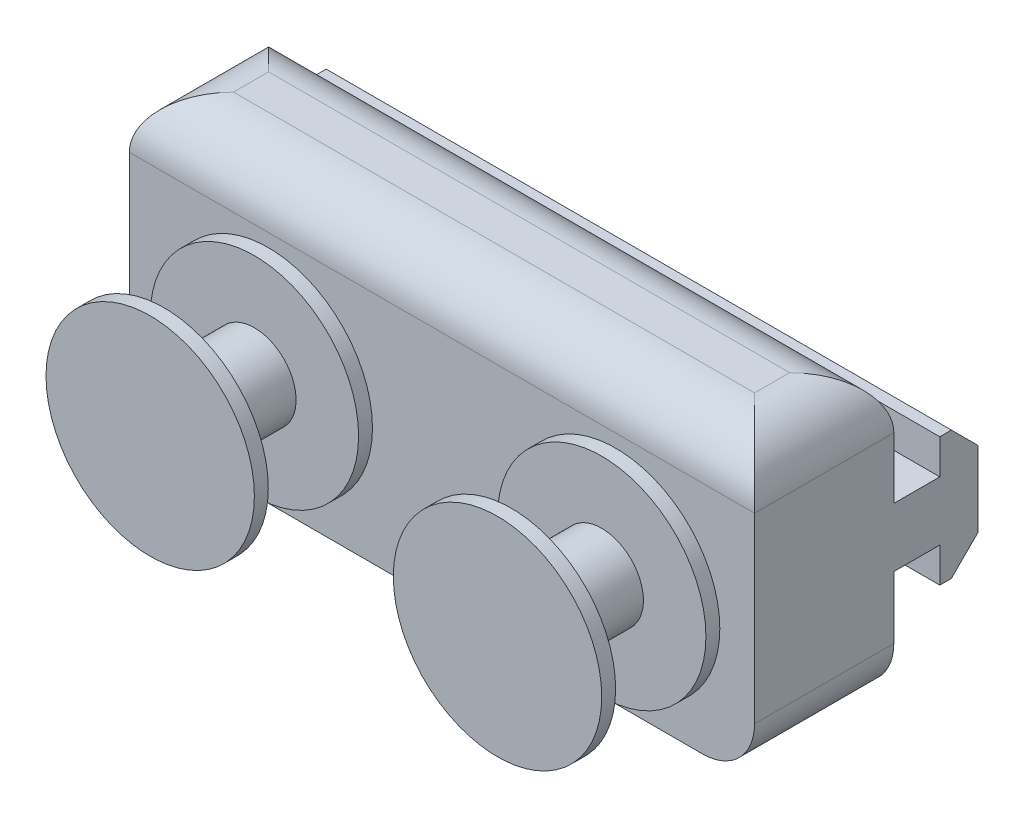
from build123d import *

# Parameters (mm, degrees)
BOSS_EXTRUDE2_DEPTH = 90
CUT_EXTRUDE1_DEPTH  = 30
FILLET1_R           = 7.5
SKETCH4_R           = 15
BOSS_EXTRUDE4_DEPTH = 2
SKETCH5_R           = 6
BOSS_EXTRUDE5_DEPTH = 13
SKETCH7_R           = 15
BOSS_EXTRUDE6_DEPTH = 2


with BuildPart() as part:
    # Sketch2 → Boss-Extrude2 (new body)
    with BuildSketch(Plane(origin=(0, 0, 0), x_dir=(0, 0, -1), z_dir=(1, 0, 0))):
        Polygon((-14.38168799, 3.616994595), (-21, 3.616994595), (-21, 19.916342715), (-41.04895965, 19.916342715), (-41.04895965, -21.33863134), (-21, -21.33863134), (-21, -4.883005405), (-14.38168799, -4.883005405), (-14.38168799, -9.883005405), (-12.710115115, -9.883005405), (-8.88168799, -6.05457828), (-8.88168799, 4.78856747), (-12.710115115, 8.616994595), (-14.38168799, 8.616994595), align=None)
    extrude(amount=BOSS_EXTRUDE2_DEPTH)

    # Sketch3 → Cut-Extrude1 (cut)
    with BuildSketch(Plane.XZ.offset(21.33863134)):
        with BuildLine():
            ThreePointArc((61.003137458, 39.024479825), (59.942477286, 38.585139997), (59.503137458, 37.524479825))
            Line((59.503137458, 37.524479825), (59.503137458, 33.024479825))
            ThreePointArc((59.503137458, 33.024479825), (59.737452033, 32.4587944), (60.303137458, 32.224479825))
            Line((60.303137458, 32.224479825), (61.603137458, 32.224479825))
            Line((61.603137458, 32.224479825), (61.603137458, 33.374479825))
            Line((61.603137458, 33.374479825), (63.496030677, 33.374479825))
            Line((63.496030677, 33.374479825), (64.203137458, 32.667373044))
            Line((64.203137458, 32.667373044), (64.203137458, 31.410120471))
            Line((64.203137458, 31.410120471), (64.425787189, 31.024479825))
            Line((64.425787189, 31.024479825), (64.203137458, 30.638839179))
            Line((64.203137458, 30.638839179), (64.203137458, 29.381586606))
            Line((64.203137458, 29.381586606), (63.496030677, 28.674479825))
            Line((63.496030677, 28.674479825), (61.603137458, 28.674479825))
            Line((61.603137458, 28.674479825), (61.603137458, 29.824479825))
            Line((61.603137458, 29.824479825), (60.303137458, 29.824479825))
            ThreePointArc((60.303137458, 29.824479825), (59.737452033, 29.59016525), (59.503137458, 29.024479825))
            Line((59.503137458, 29.024479825), (59.503137458, 24.524479825))
            ThreePointArc((59.503137458, 24.524479825), (59.942477286, 23.463819653), (61.003137458, 23.024479825))
            Line((61.003137458, 23.024479825), (65.503137458, 23.024479825))
            ThreePointArc((65.503137458, 23.024479825), (66.068822883, 23.2587944), (66.303137458, 23.824479825))
            Line((66.303137458, 23.824479825), (66.303137458, 25.124479825))
            Line((66.303137458, 25.124479825), (65.153137458, 25.124479825))
            Line((65.153137458, 25.124479825), (65.153137458, 27.017373044))
            Line((65.153137458, 27.017373044), (65.860244239, 27.724479825))
            Line((65.860244239, 27.724479825), (67.117496812, 27.724479825))
            Line((67.117496812, 27.724479825), (67.503137458, 27.947129556))
            Line((67.503137458, 27.947129556), (67.888778104, 27.724479825))
            Line((67.888778104, 27.724479825), (69.146030677, 27.724479825))
            Line((69.146030677, 27.724479825), (69.853137458, 27.017373044))
            Line((69.853137458, 27.017373044), (69.853137458, 25.124479825))
            Line((69.853137458, 25.124479825), (68.703137458, 25.124479825))
            Line((68.703137458, 25.124479825), (68.703137458, 23.824479825))
            ThreePointArc((68.703137458, 23.824479825), (68.937452033, 23.2587944), (69.503137458, 23.024479825))
            Line((69.503137458, 23.024479825), (74.003137458, 23.024479825))
            ThreePointArc((74.003137458, 23.024479825), (75.06379763, 23.463819653), (75.503137458, 24.524479825))
            Line((75.503137458, 24.524479825), (75.503137458, 29.024479825))
            ThreePointArc((75.503137458, 29.024479825), (75.268822883, 29.59016525), (74.703137458, 29.824479825))
            Line((74.703137458, 29.824479825), (73.403137458, 29.824479825))
            Line((73.403137458, 29.824479825), (73.403137458, 28.674479825))
            Line((73.403137458, 28.674479825), (71.510244239, 28.674479825))
            Line((71.510244239, 28.674479825), (70.803137458, 29.381586606))
            Line((70.803137458, 29.381586606), (70.803137458, 30.638839179))
            Line((70.803137458, 30.638839179), (70.580487727, 31.024479825))
            Line((70.580487727, 31.024479825), (70.803137458, 31.410120471))
            Line((70.803137458, 31.410120471), (70.803137458, 32.667373044))
            Line((70.803137458, 32.667373044), (71.510244239, 33.374479825))
            Line((71.510244239, 33.374479825), (73.403137458, 33.374479825))
            Line((73.403137458, 33.374479825), (73.403137458, 32.224479825))
            Line((73.403137458, 32.224479825), (74.703137458, 32.224479825))
            ThreePointArc((74.703137458, 32.224479825), (75.268822883, 32.4587944), (75.503137458, 33.024479825))
            Line((75.503137458, 33.024479825), (75.503137458, 37.524479825))
            ThreePointArc((75.503137458, 37.524479825), (75.06379763, 38.585139997), (74.003137458, 39.024479825))
            Line((74.003137458, 39.024479825), (69.503137458, 39.024479825))
            ThreePointArc((69.503137458, 39.024479825), (68.937452033, 38.79016525), (68.703137458, 38.224479825))
            Line((68.703137458, 38.224479825), (68.703137458, 36.924479825))
            Line((68.703137458, 36.924479825), (69.853137458, 36.924479825))
            Line((69.853137458, 36.924479825), (69.853137458, 35.031586606))
            Line((69.853137458, 35.031586606), (69.146030677, 34.324479825))
            Line((69.146030677, 34.324479825), (67.888778104, 34.324479825))
            Line((67.888778104, 34.324479825), (67.503137458, 34.101830094))
            Line((67.503137458, 34.101830094), (67.117496812, 34.324479825))
            Line((67.117496812, 34.324479825), (65.860244239, 34.324479825))
            Line((65.860244239, 34.324479825), (65.153137458, 35.031586606))
            Line((65.153137458, 35.031586606), (65.153137458, 36.924479825))
            Line((65.153137458, 36.924479825), (66.303137458, 36.924479825))
            Line((66.303137458, 36.924479825), (66.303137458, 38.224479825))
            ThreePointArc((66.303137458, 38.224479825), (66.068822883, 38.79016525), (65.503137458, 39.024479825))
            Line((65.503137458, 39.024479825), (61.003137458, 39.024479825))
        make_face()
        with BuildLine():
            Line((30.496862542, 33.024479825), (30.496862542, 37.524479825))
            ThreePointArc((30.496862542, 37.524479825), (30.057522714, 38.585139997), (28.996862542, 39.024479825))
            Line((28.996862542, 39.024479825), (24.496862542, 39.024479825))
            ThreePointArc((24.496862542, 39.024479825), (23.931177117, 38.79016525), (23.696862542, 38.224479825))
            Line((23.696862542, 38.224479825), (23.696862542, 36.924479825))
            Line((23.696862542, 36.924479825), (24.846862542, 36.924479825))
            Line((24.846862542, 36.924479825), (24.846862542, 35.031586606))
            Line((24.846862542, 35.031586606), (24.139755761, 34.324479825))
            Line((24.139755761, 34.324479825), (22.882503188, 34.324479825))
            Line((22.882503188, 34.324479825), (22.496862542, 34.101830094))
            Line((22.496862542, 34.101830094), (22.111221896, 34.324479825))
            Line((22.111221896, 34.324479825), (20.853969323, 34.324479825))
            Line((20.853969323, 34.324479825), (20.146862542, 35.031586606))
            Line((20.146862542, 35.031586606), (20.146862542, 36.924479825))
            Line((20.146862542, 36.924479825), (21.296862542, 36.924479825))
            Line((21.296862542, 36.924479825), (21.296862542, 38.224479825))
            ThreePointArc((21.296862542, 38.224479825), (21.062547967, 38.79016525), (20.496862542, 39.024479825))
            Line((20.496862542, 39.024479825), (15.996862542, 39.024479825))
            ThreePointArc((15.996862542, 39.024479825), (14.93620237, 38.585139997), (14.496862542, 37.524479825))
            Line((14.496862542, 37.524479825), (14.496862542, 33.024479825))
            ThreePointArc((14.496862542, 33.024479825), (14.731177117, 32.4587944), (15.296862542, 32.224479825))
            Line((15.296862542, 32.224479825), (16.596862542, 32.224479825))
            Line((16.596862542, 32.224479825), (16.596862542, 33.374479825))
            Line((16.596862542, 33.374479825), (18.489755761, 33.374479825))
            Line((18.489755761, 33.374479825), (19.196862542, 32.667373044))
            Line((19.196862542, 32.667373044), (19.196862542, 31.410120471))
            Line((19.196862542, 31.410120471), (19.419512273, 31.024479825))
            Line((19.419512273, 31.024479825), (19.196862542, 30.638839179))
            Line((19.196862542, 30.638839179), (19.196862542, 29.381586606))
            Line((19.196862542, 29.381586606), (18.489755761, 28.674479825))
            Line((18.489755761, 28.674479825), (16.596862542, 28.674479825))
            Line((16.596862542, 28.674479825), (16.596862542, 29.824479825))
            Line((16.596862542, 29.824479825), (15.296862542, 29.824479825))
            ThreePointArc((15.296862542, 29.824479825), (14.731177117, 29.59016525), (14.496862542, 29.024479825))
            Line((14.496862542, 29.024479825), (14.496862542, 24.524479825))
            ThreePointArc((14.496862542, 24.524479825), (14.93620237, 23.463819653), (15.996862542, 23.024479825))
            Line((15.996862542, 23.024479825), (20.496862542, 23.024479825))
            ThreePointArc((20.496862542, 23.024479825), (21.062547967, 23.2587944), (21.296862542, 23.824479825))
            Line((21.296862542, 23.824479825), (21.296862542, 25.124479825))
            Line((21.296862542, 25.124479825), (20.146862542, 25.124479825))
            Line((20.146862542, 25.124479825), (20.146862542, 27.017373044))
            Line((20.146862542, 27.017373044), (20.853969323, 27.724479825))
            Line((20.853969323, 27.724479825), (22.111221896, 27.724479825))
            Line((22.111221896, 27.724479825), (22.496862542, 27.947129556))
            Line((22.496862542, 27.947129556), (22.882503188, 27.724479825))
            Line((22.882503188, 27.724479825), (24.139755761, 27.724479825))
            Line((24.139755761, 27.724479825), (24.846862542, 27.017373044))
            Line((24.846862542, 27.017373044), (24.846862542, 25.124479825))
            Line((24.846862542, 25.124479825), (23.696862542, 25.124479825))
            Line((23.696862542, 25.124479825), (23.696862542, 23.824479825))
            ThreePointArc((23.696862542, 23.824479825), (23.931177117, 23.2587944), (24.496862542, 23.024479825))
            Line((24.496862542, 23.024479825), (28.996862542, 23.024479825))
            ThreePointArc((28.996862542, 23.024479825), (30.057522714, 23.463819653), (30.496862542, 24.524479825))
            Line((30.496862542, 24.524479825), (30.496862542, 29.024479825))
            ThreePointArc((30.496862542, 29.024479825), (30.262547967, 29.59016525), (29.696862542, 29.824479825))
            Line((29.696862542, 29.824479825), (28.396862542, 29.824479825))
            Line((28.396862542, 29.824479825), (28.396862542, 28.674479825))
            Line((28.396862542, 28.674479825), (26.503969323, 28.674479825))
            Line((26.503969323, 28.674479825), (25.796862542, 29.381586606))
            Line((25.796862542, 29.381586606), (25.796862542, 30.638839179))
            Line((25.796862542, 30.638839179), (25.574212811, 31.024479825))
            Line((25.574212811, 31.024479825), (25.796862542, 31.410120471))
            Line((25.796862542, 31.410120471), (25.796862542, 32.667373044))
            Line((25.796862542, 32.667373044), (26.503969323, 33.374479825))
            Line((26.503969323, 33.374479825), (28.396862542, 33.374479825))
            Line((28.396862542, 33.374479825), (28.396862542, 32.224479825))
            Line((28.396862542, 32.224479825), (29.696862542, 32.224479825))
            ThreePointArc((29.696862542, 32.224479825), (30.262547967, 32.4587944), (30.496862542, 33.024479825))
        make_face()
    extrude(amount=-CUT_EXTRUDE1_DEPTH, mode=Mode.SUBTRACT)

    # Fillet1
    fillet1_edges = [part.edges().sort_by_distance(p)[0] for p in [
        (0, -21.33863134, 31.024479825),
        (90, -21.33863134, 31.024479825),
        (90, 19.916342715, 31.024479825),
        (45, 19.916342715, 41.04895965),
        (0, 19.916342715, 31.024479825),
        (45, 19.916342715, 21),
    ]]
    fillet(fillet1_edges, radius=FILLET1_R)

    # Sketch4 → Boss-Extrude4 (add)
    with BuildSketch(Plane.XY.offset(41.04895965)):
        with Locations((20, -4.461144313)):
            Circle(SKETCH4_R)
        with Locations((70, -4.461144313)):
            Circle(SKETCH4_R)
    extrude(amount=BOSS_EXTRUDE4_DEPTH)

    # Sketch5 → Boss-Extrude5 (add)
    with BuildSketch(Plane.XY.offset(43.04895965)):
        with Locations((20, -4.461144313)):
            Circle(SKETCH5_R)
        with Locations((70, -4.461144313)):
            Circle(SKETCH5_R)
    extrude(amount=BOSS_EXTRUDE5_DEPTH)

    # Sketch7 → Boss-Extrude6 (add)
    with BuildSketch(Plane.XY.offset(56.04895965)):
        with Locations((20, -4.461144313)):
            Circle(SKETCH7_R)
        with Locations((70, -4.461144313)):
            Circle(SKETCH7_R)
    extrude(amount=BOSS_EXTRUDE6_DEPTH)


solid = part.part
